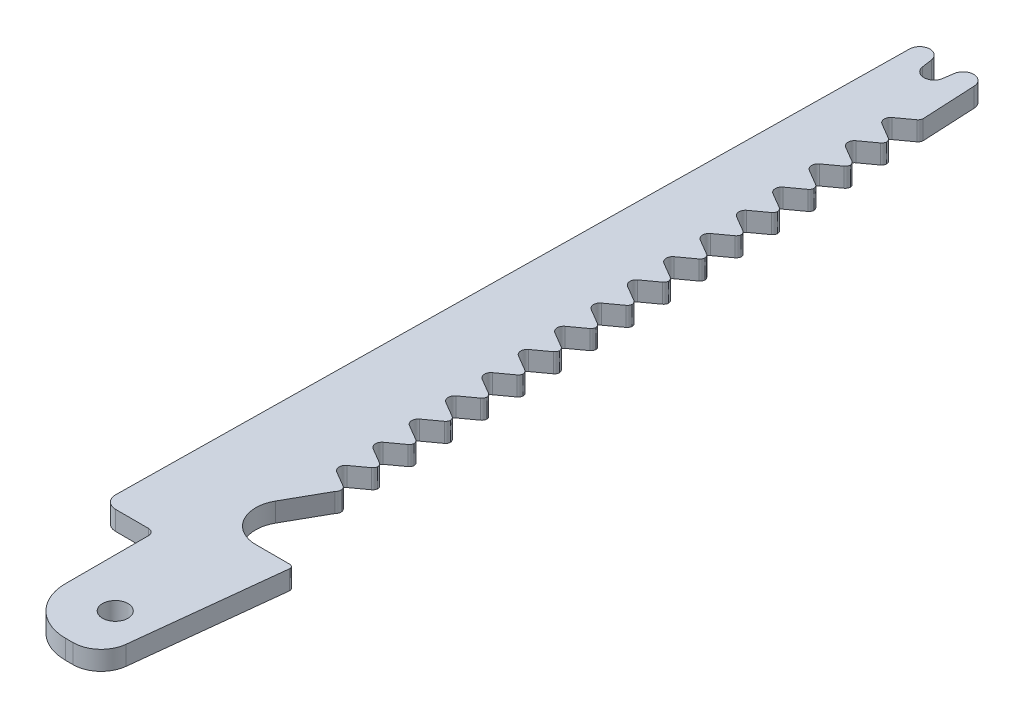
from build123d import *

# Parameters (mm, degrees)
SKETCH1_R           = 1
BOSS_EXTRUDE1_DEPTH = 1.5
FILLET1_R           = 3
CUT_EXTRUDE1_DEPTH  = 79.931932702
LPATTERN1_COUNT     = 16
LPATTERN1_PITCH     = 3
CUT_EXTRUDE2_DEPTH  = 79.931932702
FILLET2_R           = 0.3
CUT_EXTRUDE3_DEPTH  = 5
FILLET3_R           = 0.808139
FILLET4_R           = 0.823652
CUT_EXTRUDE4_DEPTH  = 1.6
FILLET10_R          = 1
FILLET11_R          = 0.5
FILLET13_R          = 3.7
FILLET14_R          = 2.2


with BuildPart() as part:
    # Sketch1 → Boss-Extrude1 (new body)
    with BuildSketch(Plane(origin=(0, 0, 0), x_dir=(1, 0, 0), z_dir=(0, 1, 0))):
        Polygon((0, 0), (0, 6), (1, 78), (6, 78), (9, 18), (12, 18), (10, 0), align=None)
        with Locations(Location((8, 8, 0), (0, 0, 270))):
            Circle(SKETCH1_R, mode=Mode.SUBTRACT)
    extrude(amount=BOSS_EXTRUDE1_DEPTH)

    # Fillet1
    fillet1_edges = [part.edges().sort_by_distance(p)[0] for p in [
        (10, 0.75, 0),
    ]]
    fillet(fillet1_edges, radius=FILLET1_R)

    # Sketch2 → Cut-Extrude1 (cut, symmetric)
    with BuildSketch(Plane(origin=(0, 1.5, 0), x_dir=(1, 0, 0), z_dir=(0, 1, 0))):
        with BuildLine():
            ThreePointArc((4.955729038, 71.878708516), (4.750594632, 71.450097336), (4.996498521, 71.04350301))
            Line((4.996498521, 71.04350301), (6.194975811, 70.338548499))
            ThreePointArc((6.194975811, 70.338548499), (6.340221232, 70.195153453), (6.4, 70))
            Line((6.4, 70), (6.25, 73))
            ThreePointArc((6.25, 73), (6.19798995, 72.829948537), (6.079849196, 72.697037636))
            Line((6.079849196, 72.697037636), (4.955729038, 71.878708516))
        make_face()
    cut_extrude1 = extrude(amount=CUT_EXTRUDE1_DEPTH, both=True, mode=Mode.SUBTRACT)

    # LPattern1: Cut-Extrude1 ×16
    with Locations(*[Vector(0.0499376169438922, 0, 0.9987523388778448) * (i * LPATTERN1_PITCH) for i in range(1, LPATTERN1_COUNT)]):
        add(cut_extrude1, mode=Mode.SUBTRACT)

    # Sketch3 → Cut-Extrude2 (cut, through all)
    with BuildSketch(Plane(origin=(0, 1.5, 0), x_dir=(1, 0, 0), z_dir=(0, 1, 0))):
        with BuildLine():
            Line((8.496742185, 24.698632232), (6.822120402, 21.727534299))
            ThreePointArc((6.822120402, 21.727534299), (6.841431522, 19.238817172), (9, 18))
            Line((9, 18), (8.647192762, 25.05614475))
            ThreePointArc((8.647192762, 25.05614475), (8.608047789, 24.862204955), (8.496742185, 24.698632232))
        make_face()
    extrude(amount=-CUT_EXTRUDE2_DEPTH, mode=Mode.SUBTRACT)

    # Fillet2
    fillet2_edges = [part.edges().sort_by_distance(p)[0] for p in [
        (12, 0.75, -18),
    ]]
    fillet(fillet2_edges, radius=FILLET2_R)

    # Sketch16 → Cut-Extrude3 (cut)
    with BuildSketch(Plane.XZ):
        with BuildLine():
            Line((6, -78), (4.5, -78))
            Line((4.5, -78), (4.292293166, -76.514450313))
            ThreePointArc((4.292293166, -76.514450313), (3.5, -75.825227292), (2.707706834, -76.514450313))
            Line((2.707706834, -76.514450313), (2.5, -78))
            Line((2.5, -78), (1, -78))
            Line((1, -78), (1, -78.416520576))
            Line((1, -78.416520576), (6, -78.416520576))
            Line((6, -78.416520576), (6, -78))
        make_face()
    extrude(amount=-CUT_EXTRUDE3_DEPTH, mode=Mode.SUBTRACT)

    # Fillet3
    fillet3_edges = [part.edges().sort_by_distance(p)[0] for p in [
        (1, 0.75, -78),
        (2.5, 0.75, -78),
    ]]
    fillet(fillet3_edges, radius=FILLET3_R - 0.0001)  # a hair under: the kernel refuses the full size

    # Fillet4
    fillet4_edges = [part.edges().sort_by_distance(p)[0] for p in [
        (6, 0.75, -78),
        (4.5, 0.75, -78),
    ]]
    fillet(fillet4_edges, radius=FILLET4_R - 0.0001)  # a hair under: the kernel refuses the full size

    # Sketch15 → Cut-Extrude4 (cut)
    with BuildSketch(Plane(origin=(0, 1.5, 0), x_dir=(1, 0, 0), z_dir=(0, 1, 0))):
        Polygon((4.2, 14.9), (4.2, 4.2), (11.363579638, 4.2), (10.97286707, 0), (4.2, 0), (0, 0), (0, 14.9), align=None)
    extrude(amount=-CUT_EXTRUDE4_DEPTH, mode=Mode.SUBTRACT)

    # Fillet10
    fillet10_edges = [part.edges().sort_by_distance(p)[0] for p in [
        (0.123611111, 0.75, -14.9),
    ]]
    fillet(fillet10_edges, radius=FILLET10_R)

    # Fillet11
    fillet11_edges = [part.edges().sort_by_distance(p)[0] for p in [
        (4.2, 0.75, -14.9),
    ]]
    fillet(fillet11_edges, radius=FILLET11_R)

    # Fillet13
    fillet13_edges = [part.edges().sort_by_distance(p)[0] for p in [
        (4.2, 0.75, -4.2),
    ]]
    fillet(fillet13_edges, radius=FILLET13_R)

    # Fillet14
    fillet14_edges = [part.edges().sort_by_distance(p)[0] for p in [
        (10.466666667, 0.75, -4.2),
    ]]
    fillet(fillet14_edges, radius=FILLET14_R)


solid = part.part
